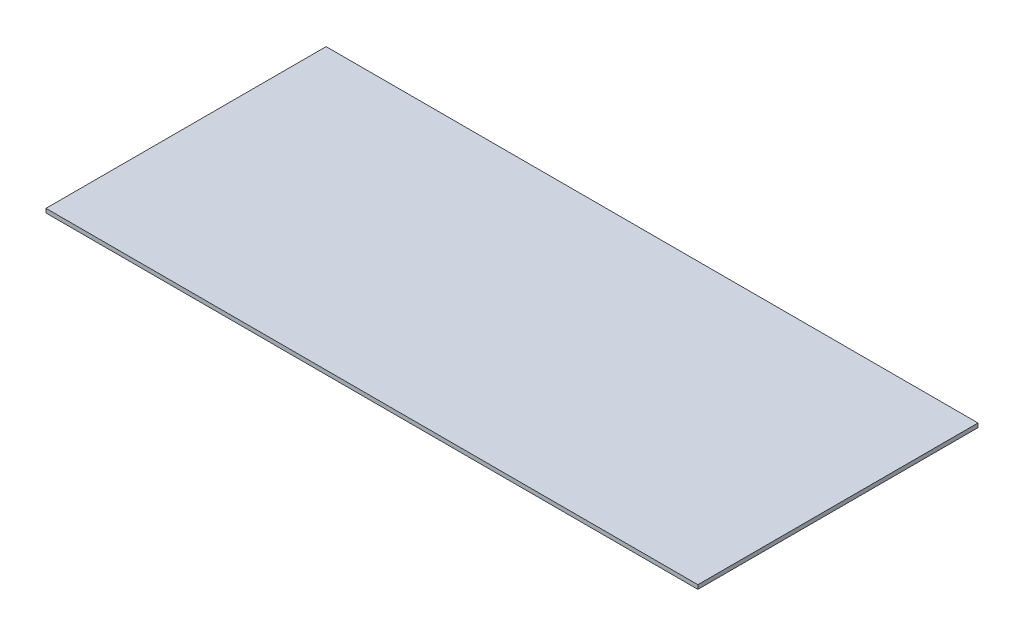
from build123d import *

# Parameters (mm, degrees)
SKETCH1_W           = 203.2
SKETCH1_H           = 87.3125
BOSS_EXTRUDE1_DEPTH = 1.27


with BuildPart() as part:
    # Sketch1 → Boss-Extrude1 (new body)
    with BuildSketch(Plane(origin=(0, 0, 0), x_dir=(1, 0, 0), z_dir=(0, 1, 0))):
        with Locations((101.6, 43.65625)):
            Rectangle(SKETCH1_W, SKETCH1_H)
    extrude(amount=BOSS_EXTRUDE1_DEPTH)


solid = part.part
